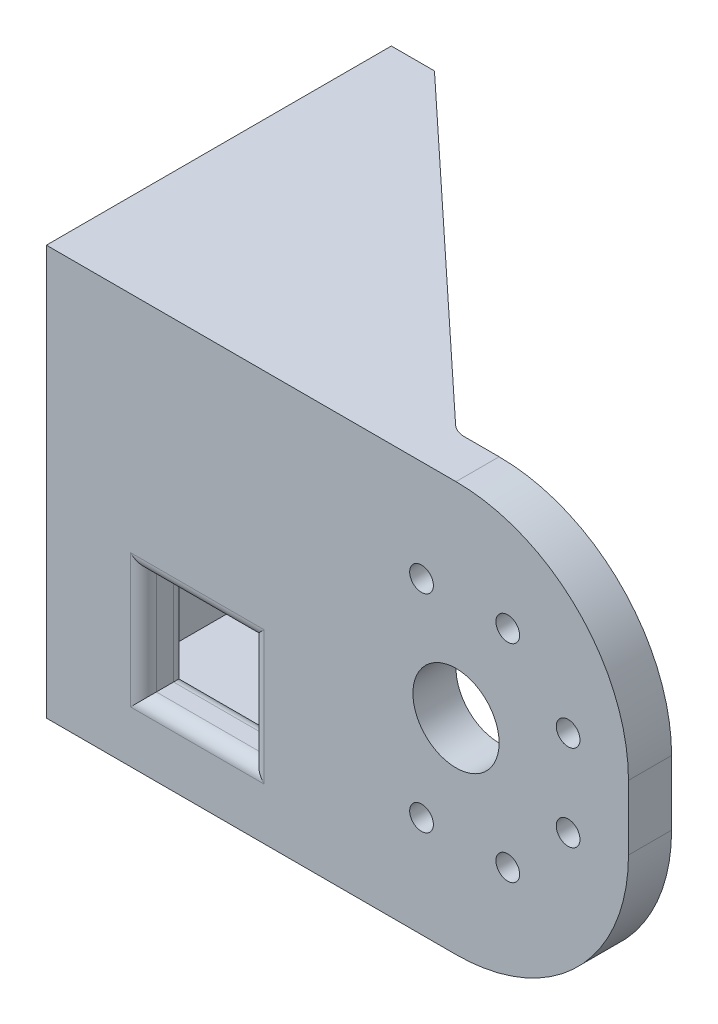
from build123d import *

# Parameters (mm, degrees)
SKETCH3_R           = 10
SKETCH3_R_2         = 2.75
BOSS_EXTRUDE1_DEPTH = 10
SKETCH4_W           = 10
SKETCH4_H           = 95
BOSS_EXTRUDE2_DEPTH = 70
SKETCH8_R           = 10
SKETCH8_R_2         = 2.75
CUT_EXTRUDE2_DEPTH  = 43.8
BOSS_EXTRUDE3_DEPTH = 10
FILLET1_R           = 5
SKETCH11_W          = 25
SKETCH11_H          = 25
CUT_EXTRUDE3_DEPTH  = 230.716194563
FILLET3_R           = 3


with BuildPart() as part:
    # Sketch3 → Boss-Extrude1 (new body)
    with BuildSketch(Plane.XY):
        with BuildLine():
            Line((68.617133813, 80.05993294), (163.617133813, 80.05993294))
            ThreePointArc((163.617133813, 80.05993294), (191.90140506, 68.344204188), (203.617133813, 40.05993294))
            Line((203.617133813, 40.05993294), (203.617133813, 25.05993294))
            ThreePointArc((203.617133813, 25.05993294), (191.90140506, -3.224338307), (163.617133813, -14.94006706))
            Line((163.617133813, -14.94006706), (68.617133813, -14.94006706))
            Line((68.617133813, -14.94006706), (68.617133813, 80.05993294))
        make_face()
        with Locations((163.617133813, 32.55993294)):
            Circle(SKETCH3_R, mode=Mode.SUBTRACT)
        with Locations((189.617133813, 42.55993294)):
            Circle(SKETCH3_R_2, mode=Mode.SUBTRACT)
        with Locations((155.617133813, 56.55993294)):
            Circle(SKETCH3_R_2, mode=Mode.SUBTRACT)
        with Locations((175.617133813, 56.55993294)):
            Circle(SKETCH3_R_2, mode=Mode.SUBTRACT)
        with Locations((155.617133813, 8.55993294)):
            Circle(SKETCH3_R_2, mode=Mode.SUBTRACT)
        with Locations((175.617133813, 8.55993294)):
            Circle(SKETCH3_R_2, mode=Mode.SUBTRACT)
        with Locations((189.617133813, 22.55993294)):
            Circle(SKETCH3_R_2, mode=Mode.SUBTRACT)
    extrude(amount=BOSS_EXTRUDE1_DEPTH)

    # Sketch4 → Boss-Extrude2 (add)
    with BuildSketch(Plane(origin=(0, 0, 0), x_dir=(-1, 0, 0), z_dir=(0, 0, -1))):
        with Locations((-73.617133813, 32.55993294)):
            Rectangle(SKETCH4_W, SKETCH4_H)
    extrude(amount=BOSS_EXTRUDE2_DEPTH)

    # Sketch8 → Cut-Extrude2 (cut)
    with BuildSketch(Plane.ZY.offset(-68.617133813)):
        with Locations((-40, 32.55993294)):
            Circle(SKETCH8_R)
        with Locations((-56.167891819, 25.862972874)):
            Circle(SKETCH8_R_2)
        with Locations((-56.167891819, 39.256893006)):
            Circle(SKETCH8_R_2)
        with Locations((-46.696960066, 48.727824759)):
            Circle(SKETCH8_R_2)
        with Locations((-33.303039934, 48.727824759)):
            Circle(SKETCH8_R_2)
        with Locations((-23.832108181, 39.256893006)):
            Circle(SKETCH8_R_2)
        with Locations((-23.832108181, 25.862972874)):
            Circle(SKETCH8_R_2)
        with Locations((-33.303039934, 16.392041121)):
            Circle(SKETCH8_R_2)
        with Locations((-46.696960066, 16.392041121)):
            Circle(SKETCH8_R_2)
    extrude(amount=-CUT_EXTRUDE2_DEPTH, mode=Mode.SUBTRACT)

    # Sketch9 → Boss-Extrude3 (add)
    with BuildSketch(Plane.XZ.offset(14.94006706)):
        Polygon((78.617133813, -70), (153.617133813, 0), (78.617133813, 0), align=None)
    boss_extrude3 = extrude(amount=-BOSS_EXTRUDE3_DEPTH)

    # Mirror1: Boss-Extrude3 across plane
    add(boss_extrude3.mirror(Plane(origin=(0, 32.55993294, 0), x_dir=(0, 0, 1), z_dir=(0, -1, 0))))

    # Fillet1
    fillet1_edges = [part.edges().sort_by_distance(p)[0] for p in [
        (153.617133813, 75.05993294, 0),
        (153.617133813, -9.94006706, 0),
    ]]
    fillet(fillet1_edges, radius=FILLET1_R)

    # Sketch11 → Cut-Extrude3 (cut, through all)
    with BuildSketch(Plane(origin=(0, 0, 0), x_dir=(-1, 0, 0), z_dir=(0, 0, -1))):
        with Locations((-103.617133813, 12.55993294)):
            Rectangle(SKETCH11_W, SKETCH11_H)
    extrude(amount=-CUT_EXTRUDE3_DEPTH, mode=Mode.SUBTRACT)

    # Fillet3
    fillet3_edges = [part.edges().sort_by_distance(p)[0] for p in [
        (116.117133813, 12.55993294, 0),
        (116.117133813, 12.55993294, 10),
        (103.617133813, 0.05993294, 10),
        (103.617133813, 0.05993294, 0),
        (91.117133813, 12.55993294, 10),
        (103.617133813, 25.05993294, 10),
        (103.617133813, 25.05993294, 0),
        (91.117133813, 12.55993294, 0),
    ]]
    fillet(fillet3_edges, radius=FILLET3_R)


solid = part.part
